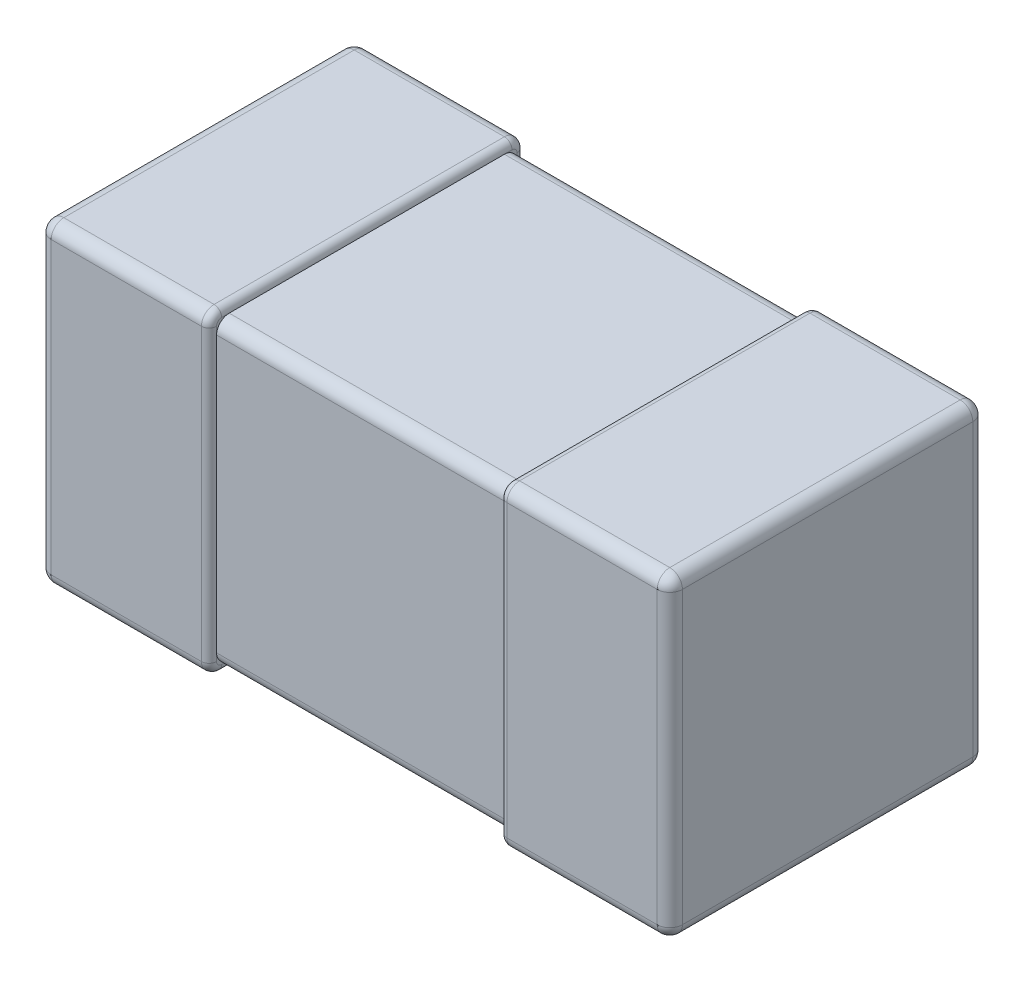
from build123d import *

# Parameters (mm, degrees)
SKETCH1_W                           = 0.25
SKETCH1_H                           = 0.125
ALL_BODY_DEPTH                      = 0.125
CUT_OUT_THE_BODY_FOR_PIN_DEPTH      = 0.0575
CUT_OUT_THE_BODY_FOR_PIN_DEPTH_BACK = 0.0575
SKETCH2_OUTSIDE_W                   = 2.187
SKETCH2_OUTSIDE_H                   = 2.186
SKETCH2_OUTSIDE_W_2                 = 0.119
SKETCH2_OUTSIDE_H_2                 = 0.119
BODY_FILLET_R                       = 0.005
PIN_FILLET_A_R                      = 0.005
PIN_FILLET_B_R                      = 0.003


with BuildPart() as part:
    # Sketch1 → All body (new body)
    with BuildSketch(Plane.XY):
        Rectangle(SKETCH1_W, SKETCH1_H)
    extrude(amount=ALL_BODY_DEPTH)

    # Sketch2 outside → Cut out the body for pin (cut, two sides: drawn at the far end of the back side and taken through both)
    with BuildSketch(Plane(origin=(0, 0, 0), x_dir=(0, 0, -1), z_dir=(1, 0, 0)).offset(-CUT_OUT_THE_BODY_FOR_PIN_DEPTH_BACK)):
        with Locations((-0.0625, 0)):
            Rectangle(SKETCH2_OUTSIDE_W, SKETCH2_OUTSIDE_H)
        with Locations((-0.0625, 0)):
            Rectangle(SKETCH2_OUTSIDE_W_2, SKETCH2_OUTSIDE_H_2, mode=Mode.SUBTRACT)
    extrude(amount=CUT_OUT_THE_BODY_FOR_PIN_DEPTH + CUT_OUT_THE_BODY_FOR_PIN_DEPTH_BACK, mode=Mode.SUBTRACT)

    # Body fillet
    body_fillet_edges = [part.edges().sort_by_distance(p)[0] for p in [
        (0, 0.0595, 0.003),
        (0, 0.0595, 0.122),
        (0, -0.0595, 0.122),
        (0, -0.0595, 0.003),
    ]]
    fillet(body_fillet_edges, radius=BODY_FILLET_R)

    # Pin fillet a
    pin_fillet_a_edges = [part.edges().sort_by_distance(p)[0] for p in [
        (0.125, 0, 0.125),
        (-0.09125, 0.0625, 0),
        (0.09125, -0.0625, 0),
        (0.09125, -0.0625, 0.125),
        (-0.09125, 0.0625, 0.125),
        (0.09125, 0.0625, 0.125),
        (-0.125, 0, 0.125),
        (0.09125, 0.0625, 0),
        (0.125, 0, 0),
        (-0.09125, -0.0625, 0),
        (-0.125, 0, 0),
        (-0.125, 0.0625, 0.0625),
        (0.125, 0.0625, 0.0625),
        (0.125, -0.0625, 0.0625),
        (-0.125, -0.0625, 0.0625),
        (-0.09125, -0.0625, 0.125),
    ]]
    fillet(pin_fillet_a_edges, radius=PIN_FILLET_A_R)

    # Pin fillet b
    pin_fillet_b_edges = [part.edges().sort_by_distance(p)[0] for p in [
        (0.0575, -0.0625, 0.0625),
        (0.0575, 0, 0.125),
        (0.0575, 0.0625, 0.0625),
        (0.0575, 0, 0),
        (-0.0575, 0.0625, 0.0625),
        (-0.0575, 0, 0.125),
        (-0.0575, -0.0625, 0.0625),
        (-0.0575, 0, 0),
        (0.0575, 0.061035534, 0.001464466),
        (0.0575, -0.061035534, 0.001464466),
        (0.0575, -0.061035534, 0.123535534),
        (0.0575, 0.061035534, 0.123535534),
        (-0.0575, -0.061035534, 0.123535534),
        (-0.0575, 0.061035534, 0.123535534),
        (-0.0575, -0.061035534, 0.001464466),
        (-0.0575, 0.061035534, 0.001464466),
    ]]
    fillet(pin_fillet_b_edges, radius=PIN_FILLET_B_R - 0.0001)  # a hair under: the kernel refuses the full size


solid = part.part
